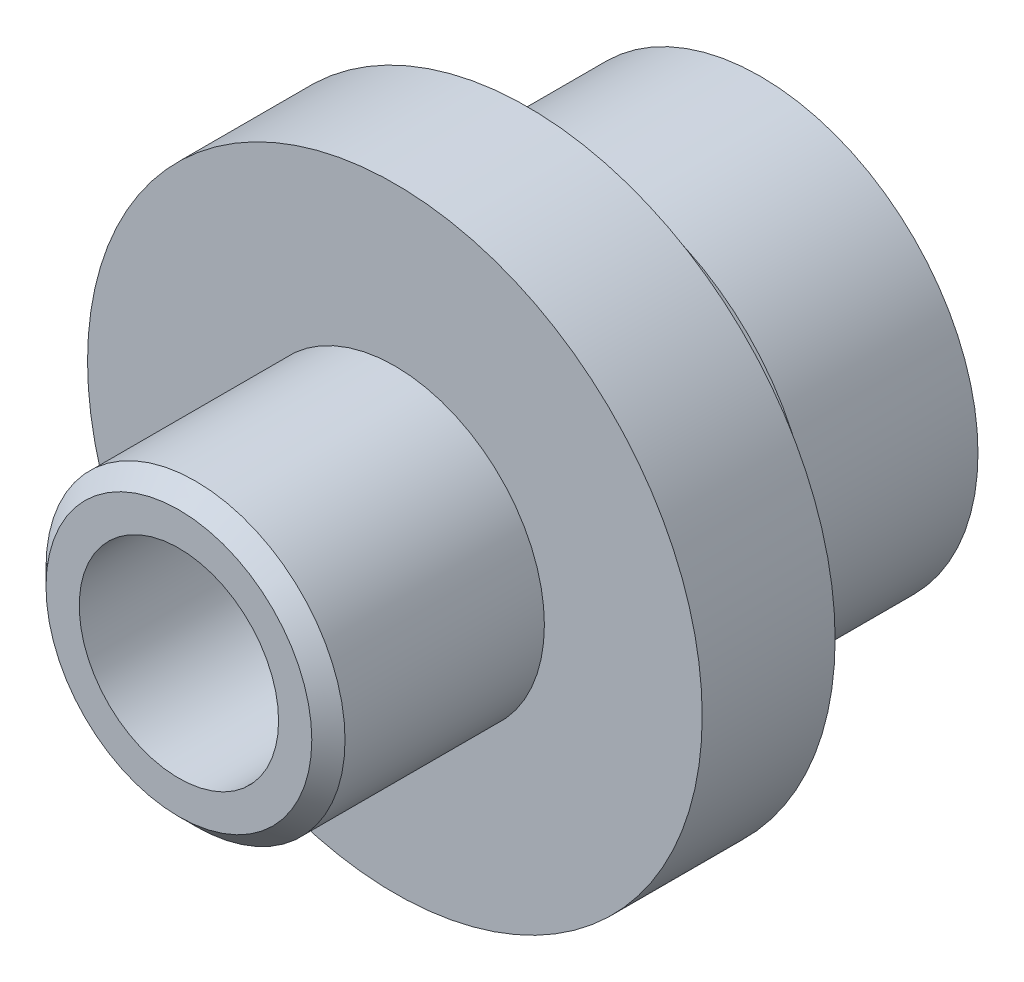
from build123d import *

# Parameters (mm, degrees)
SKETCH1_R           = 9.25
SKETCH1_R_2         = 3
BOSS_EXTRUDE1_DEPTH = 17.5
SKETCH2_OUTSIDE_W   = 26.796
SKETCH2_OUTSIDE_H   = 26.796
SKETCH2_OUTSIDE_R   = 4.5
CUT_EXTRUDE1_DEPTH  = 6.5
SKETCH3_OUTSIDE_W   = 26.796
SKETCH3_OUTSIDE_H   = 26.796
SKETCH3_OUTSIDE_R   = 6.55
CUT_EXTRUDE2_DEPTH  = 7
CUT_EXTRUDE3_START  = -5
SKETCH4_R           = 7.5
SKETCH4_R_2         = 6
CUT_EXTRUDE3_DEPTH  = 3
CHAMFER1_SIZE       = 0.5


with BuildPart() as part:
    # Sketch1 → Boss-Extrude1 (new body)
    with BuildSketch(Plane.XY):
        Circle(SKETCH1_R)
        Circle(SKETCH1_R_2, mode=Mode.SUBTRACT)
    extrude(amount=BOSS_EXTRUDE1_DEPTH)

    # Sketch2 outside → Cut-Extrude1 (cut)
    with BuildSketch(Plane.XY.offset(17.5)):
        Rectangle(SKETCH2_OUTSIDE_W, SKETCH2_OUTSIDE_H)
        Circle(SKETCH2_OUTSIDE_R, mode=Mode.SUBTRACT)
    extrude(amount=-CUT_EXTRUDE1_DEPTH, mode=Mode.SUBTRACT)

    # Sketch3 outside → Cut-Extrude2 (cut)
    with BuildSketch(Plane(origin=(0, 0, 0), x_dir=(-1, 0, 0), z_dir=(0, 0, -1))):
        Rectangle(SKETCH3_OUTSIDE_W, SKETCH3_OUTSIDE_H)
        Circle(SKETCH3_OUTSIDE_R, mode=Mode.SUBTRACT)
    extrude(amount=-CUT_EXTRUDE2_DEPTH, mode=Mode.SUBTRACT)

    # Sketch4 → Cut-Extrude3 (cut)
    with BuildSketch(Plane(origin=(0, 0, 0), x_dir=(-1, 0, 0), z_dir=(0, 0, -1)).offset(CUT_EXTRUDE3_START)):
        Circle(SKETCH4_R)
        Circle(SKETCH4_R_2, mode=Mode.SUBTRACT)
    extrude(amount=-CUT_EXTRUDE3_DEPTH, mode=Mode.SUBTRACT)

    # Chamfer1
    chamfer1_edges = [part.edges().sort_by_distance(p)[0] for p in [
        (-4.5, 0, 17.5),
    ]]
    chamfer(chamfer1_edges, length=CHAMFER1_SIZE)


solid = part.part
